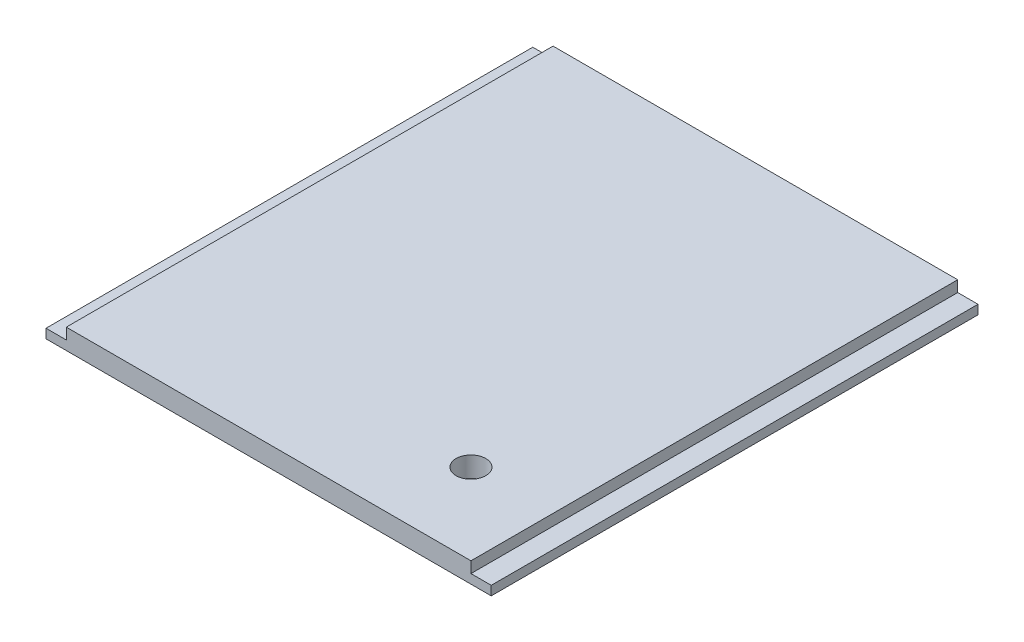
from build123d import *

# Parameters (mm, degrees)
SKETCH1_W           = 139.40028
SKETCH1_H           = 152.4
BOSS_EXTRUDE1_DEPTH = 6.35
SKETCH2_W           = 6.35
SKETCH2_H           = 152.4
CUT_EXTRUDE1_DEPTH  = 3.47472
SKETCH3_R           = 4.65836
CUT_EXTRUDE2_DEPTH  = 207.636203421


with BuildPart() as part:
    # Sketch1 → Boss-Extrude1 (new body)
    with BuildSketch(Plane(origin=(0, 0, 0), x_dir=(1, 0, 0), z_dir=(0, 1, 0))):
        with Locations((69.70014, 76.2)):
            Rectangle(SKETCH1_W, SKETCH1_H)
    extrude(amount=BOSS_EXTRUDE1_DEPTH)

    # Sketch2 → Cut-Extrude1 (cut)
    with BuildSketch(Plane(origin=(0, 6.35, 0), x_dir=(1, 0, 0), z_dir=(0, 1, 0))):
        with Locations((3.175, 76.2)):
            Rectangle(SKETCH2_W, SKETCH2_H)
        with Locations((136.22528, 76.2)):
            Rectangle(SKETCH2_W, SKETCH2_H)
    extrude(amount=-CUT_EXTRUDE1_DEPTH, mode=Mode.SUBTRACT)

    # Sketch3 → Cut-Extrude2 (cut, through all)
    with BuildSketch(Plane(origin=(0, 6.35, 0), x_dir=(1, 0, 0), z_dir=(0, 1, 0))):
        with Locations((107.65028, 25.4)):
            Circle(SKETCH3_R)
    extrude(amount=-CUT_EXTRUDE2_DEPTH, mode=Mode.SUBTRACT)


solid = part.part
